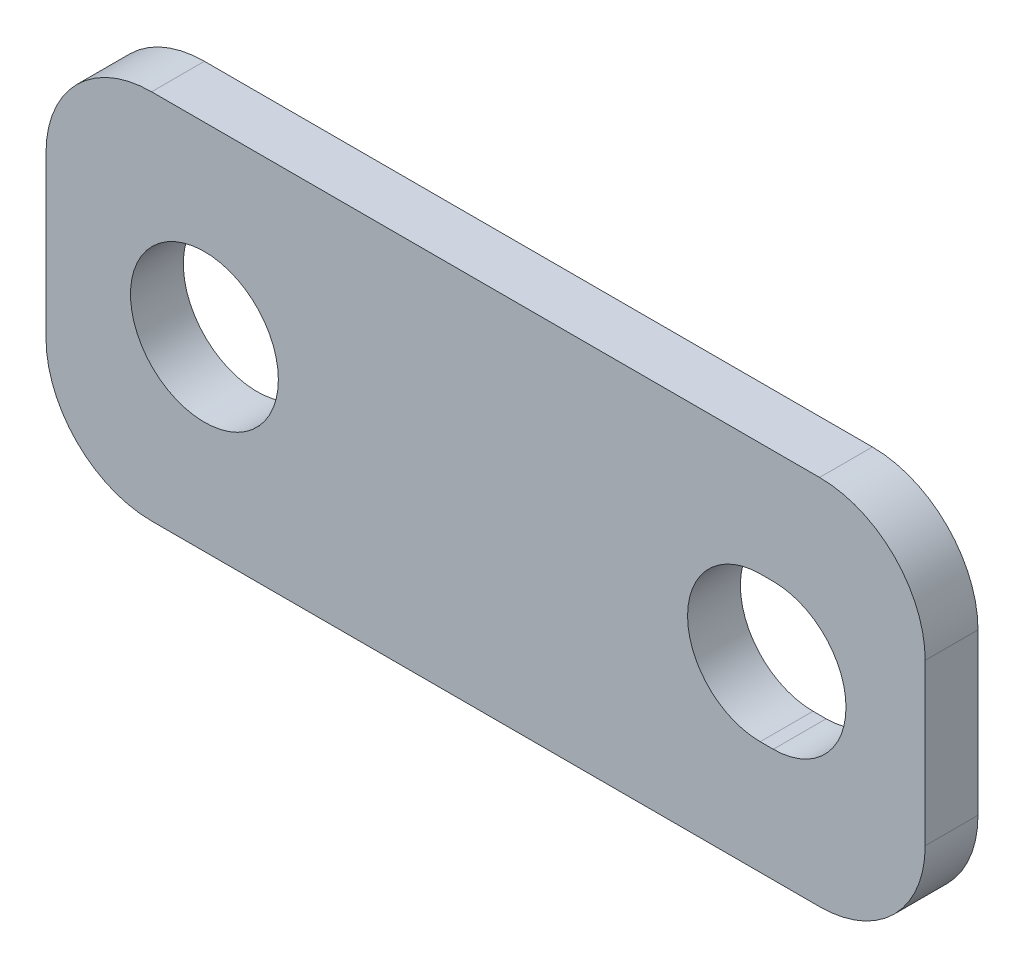
from build123d import *

# Parameters (mm, degrees)
SKETCH1_W          = 52.8624
SKETCH1_H          = 22.352
BASE_FLANGE1_DEPTH = 3.175
SKETCH6_R          = 4.445
CUT_EXTRUDE1_DEPTH = 3.175
FILLET1_R          = 6.35


# Sheet-metal steps are written as plain solids
with BuildPart() as part:
    # Sketch1 → Base-Flange1 (new body)
    with BuildSketch(Plane.XY):
        with Locations((26.4312, 11.176)):
            Rectangle(SKETCH1_W, SKETCH1_H)
    extrude(amount=-BASE_FLANGE1_DEPTH)

    # Sketch6 → Cut-Extrude1 (cut)
    with BuildSketch(Plane.XY):
        with Locations((9.525, 11.176)):
            Circle(SKETCH6_R)
        with BuildLine():
            Line((42.9437, 6.8072), (43.7311, 6.8072))
            ThreePointArc((43.7311, 6.8072), (48.0999, 11.176), (43.7311, 15.5448))
            Line((43.7311, 15.5448), (42.9437, 15.5448))
            ThreePointArc((42.9437, 15.5448), (38.5749, 11.176), (42.9437, 6.8072))
        make_face()
    extrude(amount=-CUT_EXTRUDE1_DEPTH, mode=Mode.SUBTRACT)

    # Fillet1
    fillet1_edges = [part.edges().sort_by_distance(p)[0] for p in [
        (0, 22.352, -1.5875),
        (52.8624, 22.352, -1.5875),
        (52.8624, 0, -1.5875),
        (0, 0, -1.5875),
    ]]
    fillet(fillet1_edges, radius=FILLET1_R)


solid = part.part
